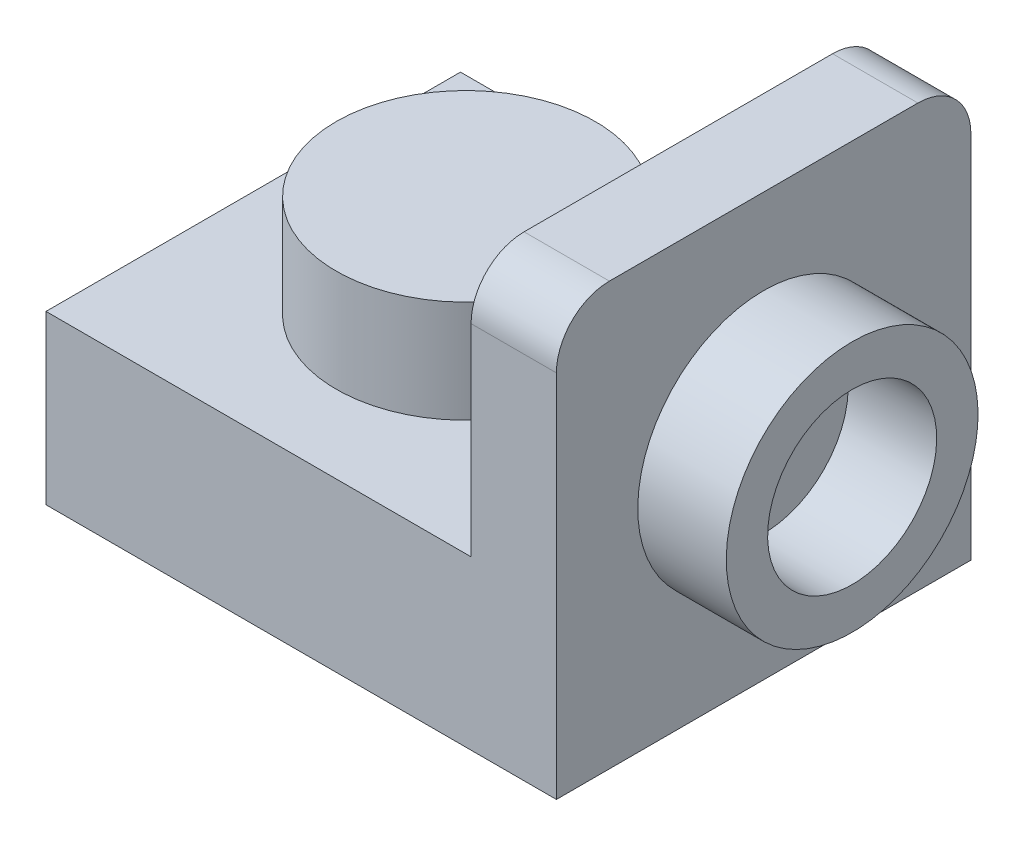
from build123d import *

# Parameters (mm, degrees)
BOSS_EXTRUDE1_DEPTH = 7.82
SKETCH2_R           = 2.445
BOSS_EXTRUDE2_DEPTH = 1.93
SKETCH3_R           = 2.375
SKETCH3_R_2         = 1.595
BOSS_EXTRUDE3_DEPTH = 1.67
SHELL1_START        = -3.16
SHELL1_OUTLINE_W    = 6.43
SHELL1_OUTLINE_H    = 4.62
SHELL1_DEPTH        = 1.56
SHELL1_START_2      = -1.6
SHELL1_2_OUTLINE_R  = 0.845
SHELL1_2_DEPTH      = 1.93
FILLET1_R           = 1


# Read off the part's stored shape, not the designer's step: Shell1
with BuildPart() as part:
    # Sketch1 → Boss-Extrude1 (new body)
    with BuildSketch(Plane.XY):
        Polygon((0, 0), (-8.02, 0), (-8.02, -3.16), (1.61, -3.16), (1.61, 4.81), (0, 4.81), align=None)
    extrude(amount=-BOSS_EXTRUDE1_DEPTH)

    # Sketch2 → Boss-Extrude2 (add)
    with BuildSketch(Plane(origin=(0, 0, 0), x_dir=(1, 0, 0), z_dir=(0, 1, 0))):
        with Locations(Location((-4.01, 3.91, 0), (0, 0, 180))):
            Circle(SKETCH2_R)
    extrude(amount=BOSS_EXTRUDE2_DEPTH)

    # Sketch3 → Boss-Extrude3 (add)
    with BuildSketch(Plane(origin=(1.61, 0, 0), x_dir=(0, 0, -1), z_dir=(1, 0, 0))):
        with Locations(Location((3.91, 0.825, 0), (0, 0, 90))):
            Circle(SKETCH3_R)
        with Locations(Location((3.91, 0.825, 0), (0, 0, 90))):
            Circle(SKETCH3_R_2, mode=Mode.SUBTRACT)
    extrude(amount=BOSS_EXTRUDE3_DEPTH)

    # Shell1 outline → Shell1 (cut)
    with BuildSketch(Plane(origin=(0, 0, 0), x_dir=(1, 0, 0), z_dir=(0, 1, 0)).offset(SHELL1_START)):
        with Locations((-3.205, 3.91)):
            Rectangle(SHELL1_OUTLINE_W, SHELL1_OUTLINE_H)
    extrude(amount=SHELL1_DEPTH, mode=Mode.SUBTRACT)

    # Shell1 2 outline → Shell1 2 (cut)
    with BuildSketch(Plane(origin=(0, 0, 0), x_dir=(1, 0, 0), z_dir=(0, 1, 0)).offset(SHELL1_START_2)):
        with Locations((-4.01, 3.91)):
            Circle(SHELL1_2_OUTLINE_R)
    extrude(amount=SHELL1_2_DEPTH, mode=Mode.SUBTRACT)

    # Fillet1
    fillet1_edges = [part.edges().sort_by_distance(p)[0] for p in [
        (0.805, 4.81, -7.82),
        (0.805, 4.81, 0),
    ]]
    fillet(fillet1_edges, radius=FILLET1_R)


solid = part.part
